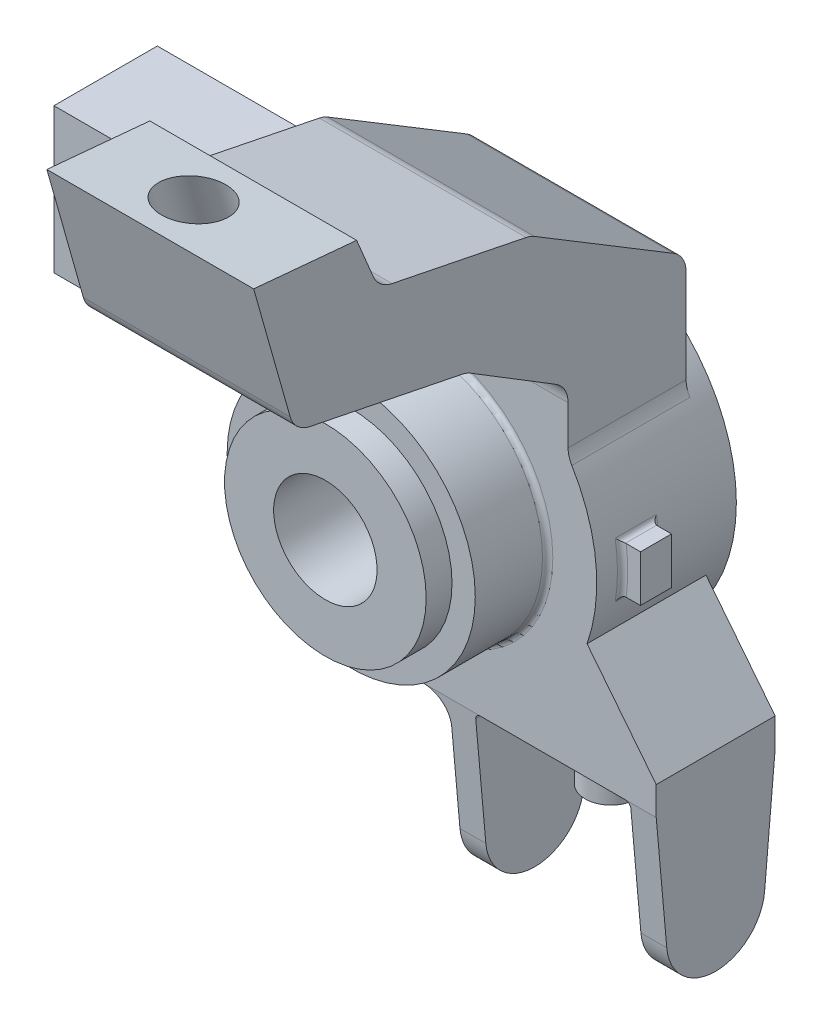
from build123d import *

# Parameters (mm, degrees)
SKETCH1_R                 = 3.35
BOSS_EXTRUDE1_DEPTH       = 2.7
SKETCH2_R                 = 2.4
BOSS_EXTRUDE2_DEPTH       = 1.4
SKETCH3_R                 = 1.95
BOSS_EXTRUDE3_DEPTH       = 0.5
F_2_0MM_DOWEL_HOLE1_D     = 2
F_2_0MM_DOWEL_HOLE1_DEPTH = 52.32
F_2_0MM_DOWEL_HOLE1_TIP   = 0.600860619
SKETCH7_W                 = 5.275172559
SKETCH7_H                 = 2.8
BOSS_EXTRUDE4_DEPTH       = 2
F_2_0MM_DOWEL_HOLE2_D     = 1.2
F_2_0MM_DOWEL_HOLE2_DEPTH = 52.32
F_2_0MM_DOWEL_HOLE2_TIP   = 0.360516371
BOSS_EXTRUDE5_DEPTH       = 2.3
BOSS_EXTRUDE6_DEPTH       = 0.5
LPATTERN1_COUNT           = 2
LPATTERN1_PITCH           = 3.5
SKETCH12_R                = 0.5
BOSS_EXTRUDE7_DEPTH       = 1
SKETCH13_W                = 0.512018779
SKETCH13_H                = 0.9
BOSS_EXTRUDE8_DEPTH       = 0.6
BOSS_EXTRUDE9_DEPTH       = 4
SKETCH6_R                 = 2.1
CUT_EXTRUDE1_DEPTH        = 2
SKETCH17_R                = 0.625
CUT_EXTRUDE2_DEPTH        = 2
FILLET1_R                 = 0.1
FILLET2_R                 = 2.7
FILLET3_R                 = 0.5
SKETCH18_R                = 2.8
CUT_EXTRUDE3_DEPTH        = 0.8
BOSS_EXTRUDE10_START      = 0.8
BOSS_EXTRUDE10_DEPTH      = 0.8


with BuildPart() as part:
    # Sketch1 → Boss-Extrude1 (new body)
    with BuildSketch(Plane.XY):
        with Locations(Location((0, 0, 0), (0, 0, 180))):
            Circle(SKETCH1_R)
    extrude(amount=BOSS_EXTRUDE1_DEPTH)

    # Sketch2 → Boss-Extrude2 (add)
    with BuildSketch(Plane.XY.offset(2.7)):
        Circle(SKETCH2_R)
    extrude(amount=BOSS_EXTRUDE2_DEPTH)

    # Sketch3 → Boss-Extrude3 (add)
    with BuildSketch(Plane.XY.offset(4.1)):
        Circle(SKETCH3_R)
    extrude(amount=BOSS_EXTRUDE3_DEPTH)

    # Ø2.0mm Dowel Hole1
    with Locations(Plane.XY.offset(4.6)):
        with Locations((0, 0)):
            Hole(F_2_0MM_DOWEL_HOLE1_D / 2, depth=F_2_0MM_DOWEL_HOLE1_DEPTH)
            with Locations((0, 0, -(F_2_0MM_DOWEL_HOLE1_DEPTH + F_2_0MM_DOWEL_HOLE1_TIP / 2))):  # 118° drill point
                Cone(0, F_2_0MM_DOWEL_HOLE1_D / 2, F_2_0MM_DOWEL_HOLE1_TIP, mode=Mode.SUBTRACT)

    # Sketch7 → Boss-Extrude4 (add)
    with BuildSketch(Plane(origin=(0, 0, 0.4), x_dir=(-1, 0, 0), z_dir=(0, 0, -1))):
        with Locations((4.812413721, 1.05)):
            Rectangle(SKETCH7_W, SKETCH7_H)
    extrude(amount=-BOSS_EXTRUDE4_DEPTH)

    # Ø2.0mm Dowel Hole2
    with Locations(Plane(origin=(0, 0, 0.4), x_dir=(-1, 0, 0), z_dir=(0, 0, -1))):
        with Locations((5.95, 1.35)):
            Hole(F_2_0MM_DOWEL_HOLE2_D / 2, depth=F_2_0MM_DOWEL_HOLE2_DEPTH)
            with Locations((0, 0, -(F_2_0MM_DOWEL_HOLE2_DEPTH + F_2_0MM_DOWEL_HOLE2_TIP / 2))):  # 118° drill point
                Cone(0, F_2_0MM_DOWEL_HOLE2_D / 2, F_2_0MM_DOWEL_HOLE2_TIP, mode=Mode.SUBTRACT)

    # Sketch10 → Boss-Extrude5 (add)
    with BuildSketch(Plane(origin=(0, 0, 0.4), x_dir=(-1, 0, 0), z_dir=(0, 0, -1))):
        with BuildLine():
            Line((0, -3.35), (-4.5, -3.35))
            Line((-4.5, -3.35), (-4.5, -2.796712357))
            Line((-4.5, -2.796712357), (-3.161899091, -1.106749357))
            ThreePointArc((-3.161899091, -1.106749357), (-1.938412966, -2.732225315), (0, -3.35))
        make_face()
    extrude(amount=-BOSS_EXTRUDE5_DEPTH)

    # Sketch11 → Boss-Extrude6 (add)
    with BuildSketch(Plane(origin=(4.5, 0, 0), x_dir=(0, 0, -1), z_dir=(1, 0, 0))):
        with BuildLine():
            Line((-2.7, -3.35), (-2.496243438, -5.634399979))
            ThreePointArc((-2.496243438, -5.634399979), (-1.55, -6.5), (-0.603756562, -5.634399979))
            Line((-0.603756562, -5.634399979), (-0.4, -3.35))
            Line((-0.4, -3.35), (-2.7, -3.35))
        make_face()
    boss_extrude6 = extrude(amount=-BOSS_EXTRUDE6_DEPTH)

    # LPattern1: Boss-Extrude6 ×2
    with Locations(*[(-i * LPATTERN1_PITCH, 0, 0) for i in range(1, LPATTERN1_COUNT)]):
        add(boss_extrude6)

    # Sketch12 → Boss-Extrude7 (add)
    with BuildSketch(Plane.XZ.offset(3.35)):
        with Locations((2.5, 1.575371986)):
            Circle(SKETCH12_R)
    extrude(amount=BOSS_EXTRUDE7_DEPTH)

    # Sketch13 → Boss-Extrude8 (add)
    with BuildSketch(Plane(origin=(0, 0, 1.6), x_dir=(-1, 0, 0), z_dir=(0, 0, -1))):
        with Locations((-3.439131456, 0)):
            Rectangle(SKETCH13_W, SKETCH13_H)
    extrude(amount=-BOSS_EXTRUDE8_DEPTH)

    # Sketch14 → Boss-Extrude9 (add)
    with BuildSketch(Plane(origin=(2.795140845, 0, 0), x_dir=(0, 0, -1), z_dir=(1, 0, 0))):
        Polygon((-0.417568245, 0.970740329), (-0.417568245, 4.082645212), (-3.42580183, 5.903958571), (-6.366262564, 6.498677554), (-6.790223471, 7.512753785), (-8.781855644, 7.695513983), (-7.993219009, 4.904805783), (-4.660696843, 4.230790935), (-2.7, 3.028431634), (-2.7, 0.970740329), align=None)
    extrude(amount=-BOSS_EXTRUDE9_DEPTH)

    # Sketch6 → Cut-Extrude1 (cut)
    with BuildSketch(Plane(origin=(0, 0, 0), x_dir=(-1, 0, 0), z_dir=(0, 0, -1))):
        Circle(SKETCH6_R)
    extrude(amount=-CUT_EXTRUDE1_DEPTH, mode=Mode.SUBTRACT)

    # Sketch17 → Cut-Extrude2 (cut, along a direction that is not the sketch's normal)
    with BuildSketch(Plane(origin=(0, 6.832124657, -0.626943304), x_dir=(1, 0, 0), z_dir=(0, 0.9958160861843439, -0.09138009901775918))):
        with Locations((0.630573116, -8.441313195)):
            Circle(SKETCH17_R)
    extrude(amount=-CUT_EXTRUDE2_DEPTH, dir=(0, 0.962313172469087, 0.2719436671306786), mode=Mode.SUBTRACT)

    # Fillet1
    fillet1_edges = [part.edges().sort_by_distance(p)[0] for p in [
        (2.1, 0, 2),
        (-2.4, 0, 2.7),
        (4, -3.35, 1.55),
        (1, -3.35, 1.55),
        (3.35, 0, 1.6),
        (3.319638535, -0.45, 1.9),
        (3.319638535, 0.45, 1.9),
        (3.35, 0, 2.2),
    ]]
    fillet(fillet1_edges, radius=FILLET1_R)

    # Fillet2
    fillet2_edges = [part.edges().sort_by_distance(p)[0] for p in [
        (-2.284731932, 2.45, 1.4),
    ]]
    fillet(fillet2_edges, radius=FILLET2_R)

    # Fillet3
    # the kernel refuses this fillet: 0.5 mm, written as the material it adds along each edge
    with BuildSketch(Plane(origin=(2.795140845, 3.028431634, 2.7), x_dir=(0, 0.522764913438525, 0.8524768884125898), z_dir=(-1, 0, 0))) as fillet3_piece_1:
        with BuildLine():
            CenterArc((FILLET3_R * 0.559821730124, -FILLET3_R), FILLET3_R, 90, 58.482100164)
            Line((-FILLET3_R * 0.292655158289, -FILLET3_R * 0.477235086561), (0, 0))
            Line((0, 0), (FILLET3_R * 0.559821730124, 0))
        make_face()
    extrude(amount=4)
    with BuildSketch(Plane(origin=(2.795140845, 4.230790935, 4.660696843), x_dir=(0, 0.19823966114604022, 0.9801535781441106), z_dir=(-1, 0, 0))) as fillet3_piece_2:
        with BuildLine():
            CenterArc((FILLET3_R * 0.177081663879, -FILLET3_R), FILLET3_R, 90, 20.083861782)
            Line((-FILLET3_R * 0.166313507063, -FILLET3_R * 0.0608089882382), (0, 0))
            Line((0, 0), (FILLET3_R * 0.177081663879, 0))
        make_face()
    extrude(amount=4)
    with BuildSketch(Plane(origin=(2.795140845, 6.498677554, 6.366262564), x_dir=(0, -0.1982396611460371, -0.9801535781441113), z_dir=(-1, 0, 0))) as fillet3_piece_3:
        with BuildLine():
            CenterArc((FILLET3_R * 0.530337057694, -FILLET3_R), FILLET3_R, 90, 55.877328997)
            Line((-FILLET3_R * 0.297501376428, -FILLET3_R * 0.439033399398), (0, 0))
            Line((0, 0), (FILLET3_R * 0.530337057694, 0))
        make_face()
    extrude(amount=4)
    with BuildSketch(Plane(origin=(2.795140845, 1.846533958, 2.7), x_dir=(0.534296962872843, -0.845296844584703, 0), z_dir=(0, 0, -1))) as fillet3_piece_4:
        with BuildLine():
            CenterArc((0.144932912, -0.49989869), FILLET3_R, 91.153417374, 31.142828348)
            Line((-0.122215569, -0.077250268), (0, 0))
            ThreePointArc((0, 0), (0.067434063, -0.000678778), (0.134868127, 0))
        make_face()
    extrude(amount=2.282431755)
    with BuildSketch(Plane(origin=(-3.33166625, -0.35, 2.4), x_dir=(0.16291161628339781, -0.9866406667474896, 0), z_dir=(0, 0, -1))) as fillet3_piece_5:
        with BuildLine():
            CenterArc((0.42435489, 0.499130817), FILLET3_R, 189.375937442, 77.245195509)
            Line((-0.068965443, 0.417675009), (0, 0))
            ThreePointArc((0, 0), (0.1974429, 0.005823524), (0.394885801, 0))
        make_face()
    extrude(amount=2)
    with BuildSketch(Plane(origin=(0.5, -3.35, 0.4), x_dir=(0, -1, 0), z_dir=(0, 0, 1))) as fillet3_piece_6_section:
        with BuildLine():
            CenterArc((FILLET3_R, -FILLET3_R), FILLET3_R, 90, 90)
            Line((0, -FILLET3_R), (0, 0))
            Line((0, 0), (FILLET3_R, 0))
        make_face()
    fillet3_piece_6 = extrude(amount=2.3, mode=Mode.PRIVATE)
    fillet3_piece_6 = split(fillet3_piece_6, bisect_by=Plane(origin=(0.386269446, -3.56317019, 2.680986331), z_dir=(0, 0.08884208299737703, -0.9960457239949817)), keep=Keep.TOP, mode=Mode.PRIVATE)
    fillet3_piece_6 = split(fillet3_piece_6, bisect_by=Plane(origin=(0.386269446, -3.56317019, 0.419013669), z_dir=(0, 0.08884208299737684, 0.9960457239949817)), keep=Keep.TOP, mode=Mode.PRIVATE)
    add(fillet3_piece_6)
    # the kernel refuses this fillet: 0.5 mm, written as the material it takes off along each edge
    with BuildSketch(Plane(origin=(3.499587338, 4.082645212, 0.417568245), x_dir=(0, 0.5179151427951786, 0.8554319989709583), z_dir=(-1, 0, 0))) as fillet3_2_piece_1:
        with BuildLine():
            CenterArc((FILLET3_R * 0.563557194242, -FILLET3_R), FILLET3_R, 90, 58.807492982)
            Line((-FILLET3_R * 0.291874804729, -FILLET3_R * 0.482084857205), (0, 0))
            Line((0, 0), (FILLET3_R * 0.563557194242, 0))
        make_face()
    extrude(amount=5.408892986, mode=Mode.SUBTRACT)
    with BuildSketch(Plane(origin=(3.557934544, 4.904805783, 7.993219009), x_dir=(0, -0.19823966114603667, -0.9801535781441112), z_dir=(-1, 0, 0))) as fillet3_2_piece_2:
        with BuildLine():
            CenterArc((FILLET3_R * 0.610234959151, -FILLET3_R), FILLET3_R, 90, 62.786002784)
            Line((-FILLET3_R * 0.279069719717, -FILLET3_R * 0.542684804382), (0, 0))
            Line((0, 0), (FILLET3_R * 0.610234959151, 0))
        make_face()
    extrude(amount=5.525587398, mode=Mode.SUBTRACT)
    with BuildSketch(Plane(origin=(3.012833965, 5.903958571, 3.42580183), x_dir=(0, 0.19823966114603944, 0.9801535781441109), z_dir=(-1, 0, 0))) as fillet3_2_piece_3:
        with BuildLine():
            CenterArc((FILLET3_R * 0.174154496328, -FILLET3_R), FILLET3_R, 90, 19.758468965)
            Line((-FILLET3_R * 0.163901334448, -FILLET3_R * 0.0588739429395), (0, 0))
            Line((0, 0), (FILLET3_R * 0.174154496328, 0))
        make_face()
    extrude(amount=4.435386241, mode=Mode.SUBTRACT)

    # Sketch18 → Cut-Extrude3 (cut)
    with BuildSketch(Plane(origin=(0, 0, 0), x_dir=(-1, 0, 0), z_dir=(0, 0, -1))):
        Circle(SKETCH18_R)
    extrude(amount=-CUT_EXTRUDE3_DEPTH, mode=Mode.SUBTRACT)

    # Sketch19 → Boss-Extrude10 (add)
    with BuildSketch(Plane(origin=(0, 0, 0.8), x_dir=(-1, 0, 0), z_dir=(0, 0, -1)).offset(BOSS_EXTRUDE10_START)):
        with BuildLine():
            Line((2.090376166, 0.200817044), (2.787168221, 0.267756059))
            ThreePointArc((2.787168221, 0.267756059), (2.791320225, -0.22029844), (2.710659376, -0.701659282))
            Line((2.710659376, -0.701659282), (2.032994532, -0.526244462))
            ThreePointArc((2.032994532, -0.526244462), (2.093490169, -0.16522383), (2.090376166, 0.200817044))
        make_face()
    extrude(amount=-BOSS_EXTRUDE10_DEPTH)


solid = part.part
